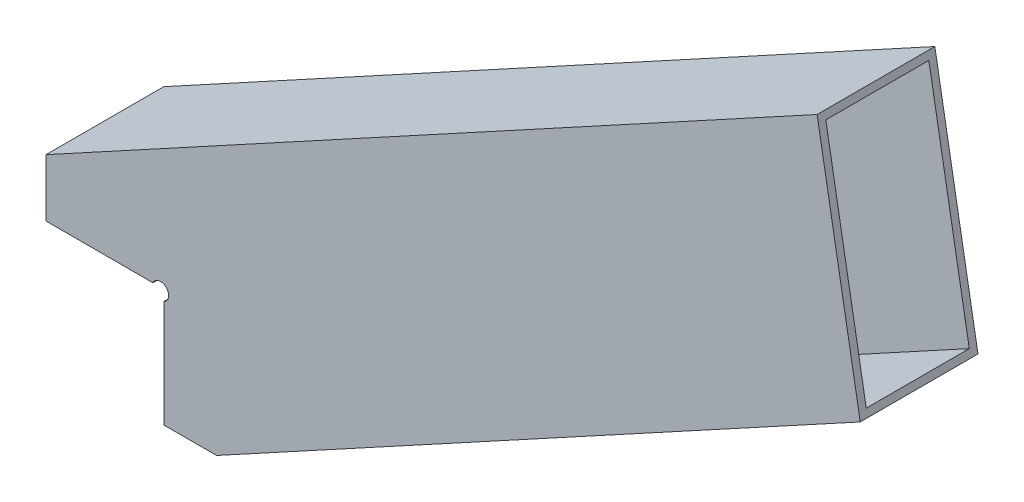
from build123d import *

# Parameters (mm, degrees)
BOSS_EXTRUDE1_DEPTH = 25.4
SHELL1_T            = -1.5875
SKETCH2_R           = 1.771315789
CUT_EXTRUDE1_DEPTH  = 204.738799344


with BuildPart() as part:
    # Sketch1 → Boss-Extrude1 (new body)
    with BuildSketch(Plane.XY):
        Polygon((144.10436, 131.64058), (-22.225, 40.975970561), (-22.225, 28.575), (3.175, 28.575), (3.175, 3.175), (14.568567723, 3.175), (153.411525172, 78.857023369), align=None)
    extrude(amount=BOSS_EXTRUDE1_DEPTH)

    # Shell1
    shell1_openings = [part.faces().sort_by_distance(p)[0] for p in [
        (-9.525, 28.575, 12.7),
        (3.175, 15.875, 12.7),
        (148.757942586, 105.248801685, 12.7),
        (8.871783861, 3.175, 12.7),
        (-22.225, 34.77548528, 12.7),
    ]]
    offset(amount=SHELL1_T, openings=shell1_openings, kind=Kind.INTERSECTION)

    # Sketch2 → Cut-Extrude1 (cut, through all)
    with BuildSketch(Plane.XY.offset(25.4)):
        with Locations((2.461305961, 27.861305961)):
            Circle(SKETCH2_R)
    extrude(amount=-CUT_EXTRUDE1_DEPTH, mode=Mode.SUBTRACT)


solid = part.part
